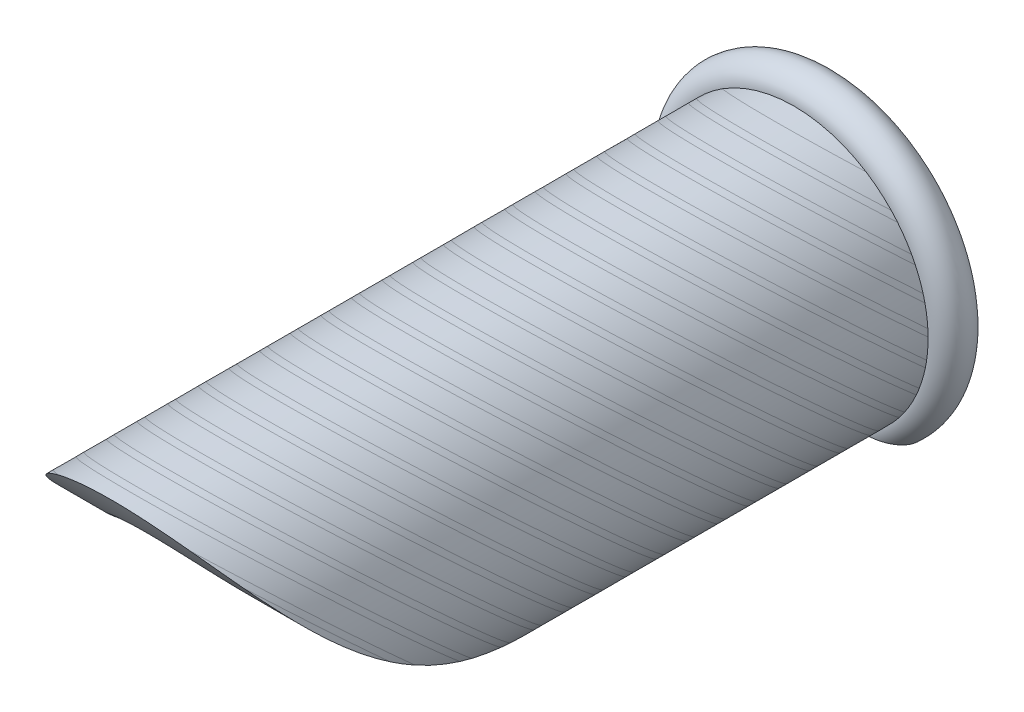
from build123d import *

# Parameters (mm, degrees)
SKETCH1_R               = 8890
BOSS_EXTRUDE1_DEPTH     = 50800
SKETCH2_W               = 29141.262563548
SKETCH2_H               = 57029.563909196
CUT_EXTRUDE1_DEPTH      = 25400
CUT_EXTRUDE2_DEPTH      = 25400
CUT_EXTRUDE2_DEPTH_BACK = 25400
SWEEP1_ANGLE            = 297.994562
SKETCH12_W              = 20976.847731124
SKETCH12_H              = 28932.252454668
CUT_EXTRUDE3_DEPTH      = 25400
CUT_EXTRUDE4_DEPTH      = 50800


# Read off the part's stored shape, not the designer's step: Sweep1
with BuildPart() as part:
    # Sketch1 → Boss-Extrude1 (new body)
    with BuildSketch(Plane.XY):
        with Locations(Location((0, 0, 0), (0, 0, 180))):
            Circle(SKETCH1_R)
    extrude(amount=BOSS_EXTRUDE1_DEPTH)

    # Sketch2 → Cut-Extrude1 (cut)
    with BuildSketch(Plane(origin=(0, -7620, 0), x_dir=(1, 0, 0), z_dir=(0, 1, 0))):
        with Locations((2441.745355227, -27759.357197192)):
            Rectangle(SKETCH2_W, SKETCH2_H)
    extrude(amount=-CUT_EXTRUDE1_DEPTH, mode=Mode.SUBTRACT)

    # Sketch3 → Cut-Extrude2 (cut, two sides: drawn at the far end of the back side and taken through both)
    with BuildSketch(Plane(origin=(0, 0, 0), x_dir=(0, 0, -1), z_dir=(1, 0, 0)).offset(-CUT_EXTRUDE2_DEPTH_BACK)):
        with BuildLine():
            Line((-53340, 30480), (-53340, -7620))
            Line((-53340, -7620), (-15240, -7620))
            ThreePointArc((-15240, -7620), (-42180.768363207, 3539.231636793), (-53340, 30480))
        make_face()
    extrude(amount=CUT_EXTRUDE2_DEPTH + CUT_EXTRUDE2_DEPTH_BACK, mode=Mode.SUBTRACT)

    # Sweep1 outline → Sweep1 (revolve)
    with BuildSketch(Plane(origin=(0, 0, 0), x_dir=(0.5150787536377125, -0.8571428571428573, 0), z_dir=(-0.8571428571428573, -0.5150787536377125, 0))):
        with BuildLine():
            Line((8890, 0), (7518.4, 0))
            ThreePointArc((7518.4, 0), (9859.867661075, -969.867661075), (8890, 1371.6))
            Line((8890, 1371.6), (8890, 0))
        make_face()
    revolve(axis=Axis((0, 0, 0), (0, 0, 1)), revolution_arc=SWEEP1_ANGLE)

    # Sketch12 → Cut-Extrude3 (cut)
    with BuildSketch(Plane(origin=(0, -7620, 0), x_dir=(1, 0, 0), z_dir=(0, 1, 0))):
        with Locations((604.624524126, -12126.720398858)):
            Rectangle(SKETCH12_W, SKETCH12_H)
    extrude(amount=-CUT_EXTRUDE3_DEPTH, mode=Mode.SUBTRACT)

    # Sketch13 → Cut-Extrude4 (cut)
    with BuildSketch(Plane(origin=(0, 0, 0), x_dir=(-1, 0, 0), z_dir=(0, 0, -1))):
        with BuildLine():
            Line((-3683, -7620), (3683, -7620))
            add(Edge.make_bspline(
                [(-3683, -7620), (184.885224272, -5220.13384139), (-10026.524629939, -946.911419479), (-30.400636249, 9069.981952492), (10024.253654619, -864.439609093), (-198.541084091, -5208.700223843), (3683, -7620)],
                knots=[0, 0, 0, 0, 0.259653938, 0.499810544, 0.738052843, 1, 1, 1, 1], degree=3))
        make_face()
    extrude(amount=-CUT_EXTRUDE4_DEPTH, mode=Mode.SUBTRACT)


solid = part.part
